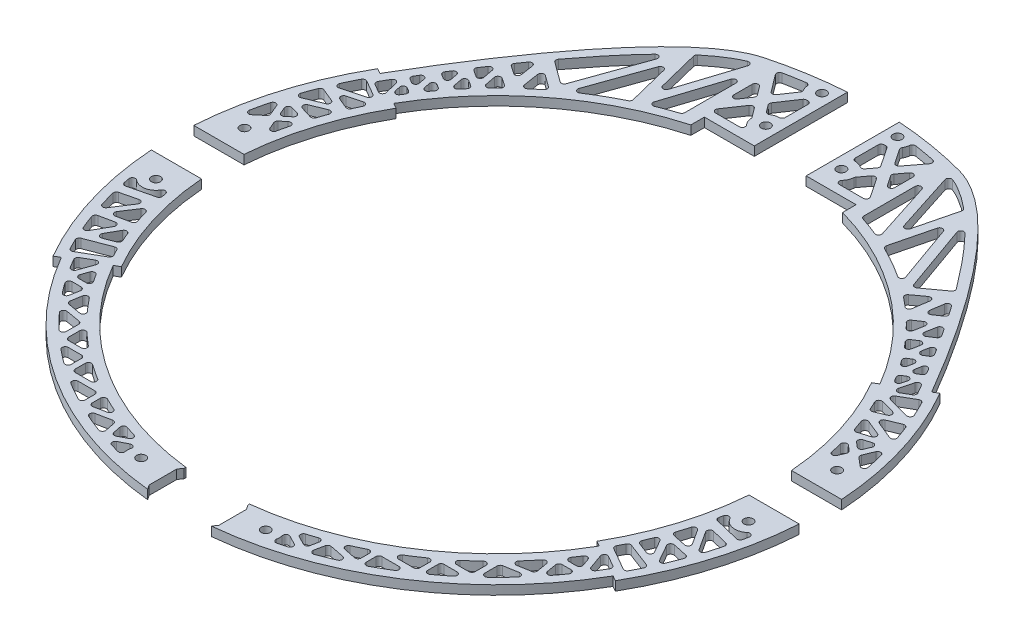
from build123d import *

# Parameters (mm, degrees)
SKETCH1_R           = 1.5
BOSS_EXTRUDE1_DEPTH = 3
CUT_EXTRUDE1_START  = -3
SKETCH2_R           = 1.5
CUT_EXTRUDE1_DEPTH  = 3
SKETCH3_R           = 1.5
CUT_EXTRUDE2_DEPTH  = 3
BOSS_EXTRUDE2_DEPTH = 3
CUT_EXTRUDE3_DEPTH  = 3
CUT_EXTRUDE4_DEPTH  = 3


with BuildPart() as part:
    # Sketch1 → Boss-Extrude1 (new body)
    with BuildSketch(Plane(origin=(0, 0, 0), x_dir=(1, 0, 0), z_dir=(0, 1, 0))):
        with BuildLine():
            Line((8.55, 124.206068692), (8.55, 93.518782826))
            Line((8.55, 93.518782826), (25, 93.518782826))
            Line((25, 93.518782826), (25, 89.057565653))
            ThreePointArc((25, 89.057565653), (0, -92.5), (-25, 89.057565653))
            Line((-25, 89.057565653), (-25, 93.518782826))
            Line((-25, 93.518782826), (-8.55, 93.518782826))
            Line((-8.55, 93.518782826), (-8.55, 124.206068692))
            ThreePointArc((-8.55, 124.206068692), (-20.481847284, 122.803680449), (-32.222971115, 120.257765373))
            add(Edge.make_bspline(
                [(-90.932667397, 52.5), (-77.178445935, 76.323010391), (-51.631984683, 115.057135862), (-32.222971115, 120.257765373)],
                knots=[0, 0, 0, 0, 1, 1, 1, 1], degree=3))
            ThreePointArc((-90.932667397, 52.5), (0, -105), (90.932667397, 52.5))
            add(Edge.make_bspline(
                [(90.932667397, 52.5), (77.178445935, 76.323010391), (51.631984683, 115.057135862), (32.222971115, 120.257765373)],
                knots=[0, 0, 0, 0, 1, 1, 1, 1], degree=3))
            ThreePointArc((32.222971115, 120.257765373), (20.481847284, 122.803680449), (8.55, 124.206068692))
        make_face()
        with Locations(Location((12.45, 101.23, 0), (0, 0, 270))):
            Circle(SKETCH1_R, mode=Mode.SUBTRACT)
        with Locations(Location((-12.45, 101.23, 0), (0, 0, 270))):
            Circle(SKETCH1_R, mode=Mode.SUBTRACT)
        with Locations(Location((12.45, 119.73, 0), (0, 0, 270))):
            Circle(SKETCH1_R, mode=Mode.SUBTRACT)
        with Locations(Location((-12.45, 119.73, 0), (0, 0, 270))):
            Circle(SKETCH1_R, mode=Mode.SUBTRACT)
    extrude(amount=BOSS_EXTRUDE1_DEPTH)

    # Sketch2 → Cut-Extrude1 (cut)
    with BuildSketch(Plane(origin=(0, 3, 0), x_dir=(1, 0, 0), z_dir=(0, 1, 0)).offset(CUT_EXTRUDE1_START)):
        with BuildLine():
            Line((-10.5, -91.902121847), (-10.5, -92.467351524))
            Line((-10.5, -92.467351524), (-11.5, -93.895499531))
            Line((-11.5, -93.895499531), (-11.5, -103.039203518))
            Line((-11.5, -103.039203518), (-10.5, -104.467351524))
            Line((-10.5, -104.467351524), (-10.5, -104.473680896))
            ThreePointArc((-10.5, -104.473680896), (0, -105), (10.5, -104.473680896))
            Line((10.5, -104.473680896), (10.5, -104.467351524))
            Line((10.5, -104.467351524), (11.5, -103.039203518))
            Line((11.5, -103.039203518), (11.5, -93.895499531))
            Line((11.5, -93.895499531), (10.5, -92.467351524))
            Line((10.5, -92.467351524), (10.5, -91.902121847))
            ThreePointArc((10.5, -91.902121847), (0, -92.5), (-10.5, -91.902121847))
        make_face()
        with Locations(Location((-20.531279468, -96.592075572, 0), (0, 0, 270))):
            Circle(SKETCH2_R)
        with Locations(Location((20.531279468, -96.592075572, 0), (0, 0, 270))):
            Circle(SKETCH2_R)
    extrude(amount=CUT_EXTRUDE1_DEPTH, mode=Mode.SUBTRACT)


with BuildPart() as cut_extrude1_piece_1:
    # of the separate pieces the step leaves, piece 1, a body of its own (cut_extrude1_pieces)
    add(part.part.solids().sort_by_distance((90.932667397, 0, -52.5))[0])


with BuildPart() as cut_extrude1_piece_2:
    # of the separate pieces the step leaves, piece 2, a body of its own (cut_extrude1_pieces)
    add(part.part.solids().sort_by_distance((-90.932667397, 0, -52.5))[0])


with BuildPart() as cut_extrude2_tool:
    # Sketch3 → Cut-Extrude2 (new body)
    with BuildSketch(Plane(origin=(0, 3, 0), x_dir=(1, 0, 0), z_dir=(0, 1, 0))):
        with Locations(Location((97.665316507, 14.596179349, 0), (0, 0, 90))):
            Circle(SKETCH3_R)
        with Locations(Location((97.665316507, -14.596179349, 0), (0, 0, 270))):
            Circle(SKETCH3_R)
        with BuildLine():
            ThreePointArc((-92.234754838, -7), (-92.5, 0), (-92.234754838, 7))
            Line((-92.234754838, 7), (-104.76640683, 7))
            ThreePointArc((-104.76640683, 7), (-105, 0), (-104.76640683, -7))
            Line((-104.76640683, -7), (-92.234754838, -7))
        make_face()
        with BuildLine():
            Line((104.76640683, 7), (92.234754838, 7))
            ThreePointArc((92.234754838, 7), (92.5, 0), (92.234754838, -7))
            Line((92.234754838, -7), (104.76640683, -7))
            ThreePointArc((104.76640683, -7), (105, 0), (104.76640683, 7))
        make_face()
        with Locations(Location((-97.665316507, 14.596179349, 0), (0, 0, 270))):
            Circle(SKETCH3_R)
        with Locations(Location((-97.665316507, -14.596179349, 0), (0, 0, 90))):
            Circle(SKETCH3_R)
    extrude(amount=-CUT_EXTRUDE2_DEPTH)


with BuildPart() as cut_extrude1_piece_1_1:
    add(cut_extrude1_piece_1.part)

    # Cut-Extrude2: cut by cut_extrude2_tool
    add(cut_extrude2_tool.part, mode=Mode.SUBTRACT)


with BuildPart() as cut_extrude1_piece_2_1:
    add(cut_extrude1_piece_2.part)

    # Cut-Extrude2: cut by cut_extrude2_tool
    add(cut_extrude2_tool.part, mode=Mode.SUBTRACT)


with BuildPart() as cut_extrude2_piece_1:
    # of the separate pieces the step leaves, piece 1, a body of its own (cut_extrude2_pieces)
    add(cut_extrude1_piece_1_1.part.solids().sort_by_distance((90.932667397, 0, -52.5))[0])



with BuildPart() as cut_extrude2_piece_2:
    # of the separate pieces the step leaves, piece 2, a body of its own (cut_extrude2_pieces)
    add(cut_extrude1_piece_1_1.part.solids().sort_by_distance((10.5, 0, 104.473680896))[0])


with BuildPart() as cut_extrude2_piece_1_of_cut_extrude1_pie:
    # of the separate pieces the step leaves, piece 1, a body of its own (cut_extrude2_pieces_of_cut_extrude1_piec)
    add(cut_extrude1_piece_2_1.part.solids().sort_by_distance((-90.932667397, 0, -52.5))[0])


with BuildPart() as cut_extrude2_piece_2_of_cut_extrude1_pie:
    # of the separate pieces the step leaves, piece 2, a body of its own (cut_extrude2_pieces_of_cut_extrude1_piec)
    add(cut_extrude1_piece_2_1.part.solids().sort_by_distance((-104.76640683, 0, 7))[0])


with BuildPart() as cut_extrude2_piece_1_1:
    add(cut_extrude2_piece_1.part)

    add(cut_extrude2_piece_2.part)  # Boss-Extrude2 merges Cut-Extrude2 piece 2

    add(cut_extrude2_piece_1_of_cut_extrude1_pie.part)  # Boss-Extrude2 merges Cut-Extrude2 piece 1 of Cut-Extrude1 pie

    add(cut_extrude2_piece_2_of_cut_extrude1_pie.part)  # Boss-Extrude2 merges Cut-Extrude2 piece 2 of Cut-Extrude1 pie
    # Sketch4 → Boss-Extrude2 (add)
    with BuildSketch(Plane(origin=(0, 3, 0), x_dir=(1, 0, 0), z_dir=(0, 1, 0))):
        with BuildLine():
            ThreePointArc((-90.228875644, 7), (-86.444245358, 26.788849258), (-78.375299042, 45.25))
            Line((-78.375299042, 45.25), (-80.10734985, 46.25))
            ThreePointArc((-80.10734985, 46.25), (-88.377547415, 27.306759473), (-92.234754838, 7))
            Line((-92.234754838, 7), (-90.228875644, 7))
        make_face()
        with BuildLine():
            Line((-80.10734985, -46.25), (-78.375299042, -45.25))
            ThreePointArc((-78.375299042, -45.25), (-86.444245358, -26.788849258), (-90.228875644, -7))
            Line((-90.228875644, -7), (-92.234754838, -7))
            ThreePointArc((-92.234754838, -7), (-88.377547415, -27.306759473), (-80.10734985, -46.25))
        make_face()
        with BuildLine():
            ThreePointArc((90.228875644, -7), (86.444245358, -26.788849258), (78.375299042, -45.25))
            Line((78.375299042, -45.25), (80.10734985, -46.25))
            ThreePointArc((80.10734985, -46.25), (88.377547415, -27.306759473), (92.234754838, -7))
            Line((92.234754838, -7), (90.228875644, -7))
        make_face()
        with BuildLine():
            Line((80.10734985, 46.25), (78.375299042, 45.25))
            ThreePointArc((78.375299042, 45.25), (86.444245358, 26.788849258), (90.228875644, 7))
            Line((90.228875644, 7), (92.234754838, 7))
            ThreePointArc((92.234754838, 7), (88.377547415, 27.306759473), (80.10734985, 46.25))
        make_face()
        with BuildLine():
            ThreePointArc((-104.76640683, 7), (-100.459416748, 30.543503183), (-90.932667397, 52.5))
            Line((-90.932667397, 52.5), (-92.664718205, 53.5))
            ThreePointArc((-92.664718205, 53.5), (-102.392344623, 31.06135481), (-106.77078252, 7))
            Line((-106.77078252, 7), (-104.76640683, 7))
        make_face()
        with BuildLine():
            Line((-92.664718205, -53.5), (-90.932667397, -52.5))
            ThreePointArc((-90.932667397, -52.5), (-100.459416748, -30.543503183), (-104.76640683, -7))
            Line((-104.76640683, -7), (-106.77078252, -7))
            ThreePointArc((-106.77078252, -7), (-102.392344623, -31.06135481), (-92.664718205, -53.5))
        make_face()
        with BuildLine():
            ThreePointArc((104.76640683, -7), (100.459416748, -30.543503183), (90.932667397, -52.5))
            Line((90.932667397, -52.5), (92.664718205, -53.5))
            ThreePointArc((92.664718205, -53.5), (102.392344623, -31.06135481), (106.77078252, -7))
            Line((106.77078252, -7), (104.76640683, -7))
        make_face()
        with BuildLine():
            Line((92.664718205, 53.5), (90.932667397, 52.5))
            ThreePointArc((90.932667397, 52.5), (100.459416748, 30.543503183), (104.76640683, 7))
            Line((104.76640683, 7), (106.77078252, 7))
            ThreePointArc((106.77078252, 7), (102.392344623, 31.06135481), (92.664718205, 53.5))
        make_face()
    extrude(amount=-BOSS_EXTRUDE2_DEPTH)

    # Sketch5 → Cut-Extrude3 (cut)
    with BuildSketch(Plane(origin=(0, 3, 0), x_dir=(1, 0, 0), z_dir=(0, 1, 0))):
        with BuildLine():
            ThreePointArc((15.771139696, 98.193549585), (15.594084197, 97.115525315), (16.509170739, 96.518782826))
            Line((16.509170739, 96.518782826), (24.312783295, 96.518782826))
            ThreePointArc((24.312783295, 96.518782826), (25.195539792, 97.048952042), (25.14227565, 98.077300895))
            Line((25.14227565, 98.077300895), (20.969415049, 104.274693892))
            ThreePointArc((20.969415049, 104.274693892), (20.167820715, 104.715786597), (19.342872494, 104.320088879))
            Line((19.342872494, 104.320088879), (17.136434804, 101.408011413))
            ThreePointArc((17.136434804, 101.408011413), (16.99863425, 101.159139295), (16.936487731, 100.881535019))
            ThreePointArc((16.936487731, 100.881535019), (16.578689614, 99.440049702), (15.771139696, 98.193549585))
        make_face()
        with BuildLine():
            Line((21.176876677, 111.708227546), (25.449565454, 117.347362866))
            ThreePointArc((25.449565454, 117.347362866), (25.589052551, 118.30184388), (24.857100444, 118.930124685))
            ThreePointArc((24.857100444, 118.930124685), (21.471750721, 119.587682982), (18.069102618, 120.148897334))
            ThreePointArc((18.069102618, 120.148897334), (17.308175343, 119.950712436), (16.925770138, 119.263650699))
            ThreePointArc((16.925770138, 119.263650699), (16.733136251, 118.349875419), (16.356043426, 117.495537033))
            ThreePointArc((16.356043426, 117.495537033), (16.224718793, 116.962506989), (16.394560722, 116.440471638))
            Line((16.394560722, 116.440471638), (19.550334122, 111.753622534))
            ThreePointArc((19.550334122, 111.753622534), (20.351928456, 111.312529828), (21.176876677, 111.708227546))
        make_face()
        with BuildLine():
            add(Edge.make_bspline(
                [(88.959591186, 49.917468245), (88.886674519, 50.043763617), (88.650753679, 50.452386883), (88.253042769, 51.141186814), (87.792023732, 51.937483892), (87.488953041, 52.457957818), (87.351699826, 52.693104953)],
                knots=[-0.015146865, -0.015146865, -0.015146865, -0.015146865, -0.009845462, 0.002005654, 0.01385677, 0.023524648, 0.023524648, 0.023524648, 0.023524648], degree=3))
            ThreePointArc((87.351699826, 52.693104953), (86.348707043, 53.179247049), (85.518830612, 52.435181346))
            Line((85.518830612, 52.435181346), (84.418009146, 48.101144507))
            ThreePointArc((84.418009146, 48.101144507), (84.783667855, 47.057653731), (85.887233849, 46.988941371))
            Line((85.887233849, 46.988941371), (88.593565782, 48.551442841))
            ThreePointArc((88.593565782, 48.551442841), (89.059491609, 49.1586492), (88.959591186, 49.917468245))
        make_face()
        with BuildLine():
            ThreePointArc((36.292776535, 88.335068752), (37.351586268, 88.525702217), (37.624762255, 89.566276121))
            Line((37.624762255, 89.566276121), (31.451956646, 108.755085379))
            ThreePointArc((31.451956646, 108.755085379), (30.345010719, 109.436768703), (29.5, 108.448852552))
            Line((29.5, 108.448852552), (29.5, 91.553263186))
            ThreePointArc((29.5, 91.553263186), (29.688808846, 90.968482106), (30.183937824, 90.604524707))
            ThreePointArc((30.183937824, 90.604524707), (33.257720842, 89.521919128), (36.292776535, 88.335068752))
        make_face()
        with BuildLine():
            ThreePointArc((91.558654112, 18.954230588), (92.437385792, 18.165650654), (93.450568977, 18.771858135))
            Line((93.450568977, 18.771858135), (94.38215342, 20.997996722))
            ThreePointArc((94.38215342, 20.997996722), (94.431387061, 21.620181583), (94.102100027, 22.150377774))
            Line((94.102100027, 22.150377774), (92.334283145, 23.632346882))
            ThreePointArc((92.334283145, 23.632346882), (91.161715709, 23.71391428), (90.721568957, 22.624034254))
            ThreePointArc((90.721568957, 22.624034254), (91.158580481, 20.793345202), (91.558654112, 18.954230588))
        make_face()
        with BuildLine():
            add(Edge.make_bspline(
                [(65.576485339, 85.982407931), (65.451859982, 86.149877435), (64.425754559, 87.525250843), (61.093004912, 91.898768129), (57.241981977, 96.59791856), (54.020874303, 100.210119699), (52.861563451, 101.474730679), (51.992695079, 102.404383534), (51.414099417, 103.011086715), (51.125025587, 103.311039195)],
                knots=[0.431471777, 0.431471777, 0.431471777, 0.431471777, 0.437594107, 0.481823762, 0.593562485, 0.621121653, 0.634901237, 0.64868082, 0.662460404, 0.662460404, 0.662460404, 0.662460404], degree=3))
            ThreePointArc((51.125025587, 103.311039195), (49.878518211, 103.467307685), (49.462876453, 102.281794121))
            Line((49.462876453, 102.281794121), (57.293930119, 80.27962879))
            ThreePointArc((57.293930119, 80.27962879), (57.941222423, 79.659390035), (58.825451357, 79.807114889))
            Line((58.825451357, 79.807114889), (65.363660534, 84.577576759))
            ThreePointArc((65.363660534, 84.577576759), (65.762963443, 85.235620917), (65.576485339, 85.982407931))
        make_face()
        with BuildLine():
            ThreePointArc((52.346038416, 79.875792717), (53.512251958, 79.926079134), (53.836270155, 81.047504547))
            Line((53.836270155, 81.047504547), (46.977775231, 100.317164245))
            ThreePointArc((46.977775231, 100.317164245), (45.986895055, 100.980657967), (45.065375499, 100.223776768))
            Line((45.065375499, 100.223776768), (41.715312962, 86.787806359))
            ThreePointArc((41.715312962, 86.787806359), (41.778366377, 86.125265771), (42.243269116, 85.649029267))
            ThreePointArc((42.243269116, 85.649029267), (47.382663917, 82.916422741), (52.346038416, 79.875792717))
        make_face()
        with BuildLine():
            ThreePointArc((66.920240095, 68.131721434), (67.780188465, 67.27626663), (68.629202271, 66.409958557))
            ThreePointArc((68.629202271, 66.409958557), (69.633403078, 66.146993064), (70.329881739, 66.916725216))
            Line((70.329881739, 66.916725216), (70.973259254, 70.266367943))
            ThreePointArc((70.973259254, 70.266367943), (70.54087792, 71.290376888), (69.429355738, 71.282229635))
            Line((69.429355738, 71.282229635), (67.059121155, 69.672378716))
            ThreePointArc((67.059121155, 69.672378716), (66.625013972, 68.934922598), (66.920240095, 68.131721434))
        make_face()
        with BuildLine():
            ThreePointArc((38.879836652, 95.461214294), (39.865227157, 94.768006189), (40.802087348, 95.525518504))
            Line((40.802087348, 95.525518504), (44.190986639, 109.117250032))
            ThreePointArc((44.190986639, 109.117250032), (44.170954431, 109.670630784), (43.859541965, 110.128510486))
            add(Edge.make_bspline(
                [(43.859541965, 110.128510486), (43.714200276, 110.249201511), (43.178837474, 110.689972499), (41.339002971, 112.15592036), (39.040680832, 113.782507978), (36.580089233, 115.23991269), (35.126404338, 115.978964725), (34.220431062, 116.381321735), (33.89740265, 116.516295368), (33.82601455, 116.545703493)],
                knots=[0.779326404, 0.779326404, 0.779326404, 0.779326404, 0.786470938, 0.805683911, 0.870455941, 0.902841955, 0.93522797, 0.949449093, 0.953497345, 0.953497345, 0.953497345, 0.953497345], degree=3))
            ThreePointArc((33.82601455, 116.545703493), (32.766683338, 116.355743232), (32.493163859, 115.314851973))
            Line((32.493163859, 115.314851973), (38.879836652, 95.461214294))
        make_face()
        with BuildLine():
            ThreePointArc((81.649002717, 56.179477011), (82.056589073, 55.172320689), (83.142323212, 55.13143213))
            Line((83.142323212, 55.13143213), (84.329922148, 55.837938707))
            ThreePointArc((84.329922148, 55.837938707), (84.788383712, 56.453190144), (84.67594278, 57.212188414))
            add(Edge.make_bspline(
                [(84.67594278, 57.212188414), (84.610035047, 57.321937517), (84.477849627, 57.541826039), (84.278470121, 57.872807104), (84.07799773, 58.204913791), (83.943626543, 58.427053554), (83.876261633, 58.538303485)],
                knots=[0.083568359, 0.083568359, 0.083568359, 0.083568359, 0.087823193, 0.092078027, 0.096332862, 0.100587696, 0.100587696, 0.100587696, 0.100587696], degree=3))
            ThreePointArc((83.876261633, 58.538303485), (82.844434309, 59.004648862), (82.038812719, 58.2089608))
            Line((82.038812719, 58.2089608), (81.649002717, 56.179477011))
        make_face()
        with BuildLine():
            add(Edge.make_bspline(
                [(76.554021543, 70.185674015), (76.462254536, 70.326147652), (76.242099412, 70.662659737), (75.892098303, 71.195754797), (75.515806706, 71.766509828), (75.267783546, 72.141200933), (75.14963253, 72.31934865)],
                knots=[0.243154782, 0.243154782, 0.243154782, 0.243154782, 0.248174192, 0.255172678, 0.262171163, 0.268509957, 0.268509957, 0.268509957, 0.268509957], degree=3))
            ThreePointArc((75.14963253, 72.31934865), (74.119623496, 72.747115689), (73.334209586, 71.955264541))
            Line((73.334209586, 71.955264541), (72.669315142, 68.493597341))
            ThreePointArc((72.669315142, 68.493597341), (73.09202733, 67.476031329), (74.193845081, 67.464903602))
            Line((74.193845081, 67.464903602), (76.259311367, 68.798695288))
            ThreePointArc((76.259311367, 68.798695288), (76.694992627, 69.430920081), (76.554021543, 70.185674015))
        make_face()
        with BuildLine():
            ThreePointArc((80.369978822, 62.331958075), (80.817663469, 62.955510747), (80.691459104, 63.712684397))
            add(Edge.make_bspline(
                [(80.691459104, 63.712684397), (80.616427748, 63.832606707), (80.466026789, 64.072714457), (80.239420064, 64.433640336), (80.011817511, 64.795305334), (79.859424897, 65.03689132), (79.78306577, 65.157799121)],
                knots=[0.165136897, 0.165136897, 0.165136897, 0.165136897, 0.169541528, 0.173946158, 0.178350789, 0.182755419, 0.182755419, 0.182755419, 0.182755419], degree=3))
            ThreePointArc((79.78306577, 65.157799121), (78.751883089, 65.60643447), (77.955516123, 64.812450179))
            Line((77.955516123, 64.812450179), (77.519028403, 62.53994627))
            ThreePointArc((77.519028403, 62.53994627), (77.933814216, 61.527784179), (79.027341513, 61.500999477))
            Line((79.027341513, 61.500999477), (80.369978822, 62.331958075))
        make_face()
        with BuildLine():
            ThreePointArc((100.337441123, 19.533055206), (101.490362199, 19.439516486), (101.96025825, 20.496481103))
            ThreePointArc((101.96025825, 20.496481103), (101.34790981, 23.336691651), (100.656460464, 26.158688173))
            ThreePointArc((100.656460464, 26.158688173), (99.759587607, 26.904640226), (98.766126461, 26.29319903))
            Line((98.766126461, 26.29319903), (97.36420905, 22.943140463))
            ThreePointArc((97.36420905, 22.943140463), (97.314975409, 22.320955602), (97.644262443, 21.79075941))
            Line((97.644262443, 21.79075941), (100.337441123, 19.533055206))
        make_face()
        with BuildLine():
            add(Edge.make_bspline(
                [(71.584188946, 77.590303623), (71.465264634, 77.762581422), (71.16135202, 78.201928449), (70.703462679, 78.860340295), (70.210285796, 79.565228326), (69.902315661, 80.00297908), (69.748022917, 80.221677404)],
                knots=[0.330931187, 0.330931187, 0.330931187, 0.330931187, 0.337056351, 0.346556359, 0.354368946, 0.362181532, 0.362181532, 0.362181532, 0.362181532], degree=3))
            ThreePointArc((69.748022917, 80.221677404), (68.702001425, 80.618648044), (67.9425152, 79.797108437))
            Line((67.9425152, 79.797108437), (67.279065931, 75.480363684))
            ThreePointArc((67.279065931, 75.480363684), (67.733451987, 74.482976221), (68.82931495, 74.501219198))
            Line((68.82931495, 74.501219198), (71.323080811, 76.194971916))
            ThreePointArc((71.323080811, 76.194971916), (71.744164409, 76.838271038), (71.584188946, 77.590303623))
        make_face()
        with BuildLine():
            ThreePointArc((12.531818182, 115.230743863), (11.836493932, 114.931558216), (11.55, 114.230909166))
            Line((11.55, 114.230909166), (11.55, 106.729090834))
            ThreePointArc((11.55, 106.729090834), (11.836493932, 106.028441784), (12.531818182, 105.729256137))
            ThreePointArc((12.531818182, 105.729256137), (13.777397803, 105.529769188), (14.918669283, 104.99240242))
            ThreePointArc((14.918669283, 104.99240242), (15.637289485, 104.843052447), (16.264312657, 105.224578791))
            Line((16.264312657, 105.224578791), (17.985312249, 107.495970434))
            ThreePointArc((17.985312249, 107.495970434), (18.187872824, 108.071985469), (18.017754404, 108.658401559))
            Line((18.017754404, 108.658401559), (13.868868703, 114.820187837))
            ThreePointArc((13.868868703, 114.820187837), (13.461164272, 115.168364285), (12.932217012, 115.255911629))
            ThreePointArc((12.932217012, 115.255911629), (12.732298209, 115.238863427), (12.531818182, 115.230743863))
        make_face()
        with BuildLine():
            ThreePointArc((24.670507645, 104.149312069), (25.791982572, 103.751406498), (26.5, 104.707830137))
            Line((26.5, 104.707830137), (26.5, 110.790456873))
            ThreePointArc((26.5, 110.790456873), (25.818551252, 111.738362512), (24.7029498, 111.394369929))
            Line((24.7029498, 111.394369929), (22.534436922, 108.532345991))
            ThreePointArc((22.534436922, 108.532345991), (22.331876347, 107.956330956), (22.501994767, 107.369914866))
            Line((22.501994767, 107.369914866), (24.670507645, 104.149312069))
        make_face()
        with BuildLine():
            Line((63.091095996, 79.205796917), (59.323143512, 76.456592484))
            ThreePointArc((59.323143512, 76.456592484), (58.912754077, 75.668510406), (59.291703534, 74.864837488))
            ThreePointArc((59.291703534, 74.864837488), (60.772898101, 73.667529186), (62.229920881, 72.440920391))
            ThreePointArc((62.229920881, 72.440920391), (63.228465997, 72.261570412), (63.86993767, 73.04755569))
            Line((63.86993767, 73.04755569), (64.668906132, 78.24605855))
            ThreePointArc((64.668906132, 78.24605855), (64.200194627, 79.252326038), (63.091095996, 79.205796917))
        make_face()
        with BuildLine():
            Line((74.256842297, 65.124825371), (72.452061867, 63.959373701))
            ThreePointArc((72.452061867, 63.959373701), (72.004638611, 63.261044165), (72.238122597, 62.465219472))
            ThreePointArc((72.238122597, 62.465219472), (72.879655804, 61.715522924), (73.513408925, 60.959238088))
            ThreePointArc((73.513408925, 60.959238088), (74.531820521, 60.628958153), (75.265231918, 61.408929139))
            Line((75.265231918, 61.408929139), (75.781372236, 64.096131632))
            ThreePointArc((75.781372236, 64.096131632), (75.358660048, 65.113697644), (74.256842297, 65.124825371))
        make_face()
        with BuildLine():
            Line((78.400407474, 58.760937493), (77.212084142, 58.025483857))
            ThreePointArc((77.212084142, 58.025483857), (76.756576089, 57.365224668), (76.932769436, 56.58267391))
            ThreePointArc((76.932769436, 56.58267391), (77.3443434, 56.018769569), (77.751784124, 55.451871615))
            ThreePointArc((77.751784124, 55.451871615), (78.779170005, 55.055517689), (79.547988009, 55.843893907))
            Line((79.547988009, 55.843893907), (79.908720584, 57.7219907))
            ThreePointArc((79.908720584, 57.7219907), (79.493934771, 58.734152791), (78.400407474, 58.760937493))
        make_face()
        with BuildLine():
            Line((82.328428862, 52.901879094), (81.184512487, 52.221359419))
            ThreePointArc((81.184512487, 52.221359419), (80.723605744, 51.596182783), (80.849195469, 50.829692031))
            ThreePointArc((80.849195469, 50.829692031), (81.191807227, 50.280616933), (81.530690085, 49.729232594))
            ThreePointArc((81.530690085, 49.729232594), (82.533341139, 49.261109282), (83.353639291, 50.00377981))
            Line((83.353639291, 50.00377981), (83.808924981, 51.796282059))
            ThreePointArc((83.808924981, 51.796282059), (83.438045082, 52.843698517), (82.328428862, 52.901879094))
        make_face()
        with BuildLine():
            Line((90.980713201, 48.197612239), (86.098738616, 45.379002898))
            ThreePointArc((86.098738616, 45.379002898), (85.607293755, 44.382451302), (86.339919571, 43.547051668))
            Line((86.339919571, 43.547051668), (93.524269183, 41.622010991))
            ThreePointArc((93.524269183, 41.622010991), (94.545888189, 41.941302284), (94.693603648, 43.001411932))
            ThreePointArc((94.693603648, 43.001411932), (93.56189444, 45.411143003), (92.368875465, 47.791116804))
            ThreePointArc((92.368875465, 47.791116804), (91.761741883, 48.291286204), (90.980713201, 48.197612239))
        make_face()
        with BuildLine():
            Line((90.097162893, 40.469748993), (85.532279791, 41.692905734))
            ThreePointArc((85.532279791, 41.692905734), (84.504455183, 41.366221993), (84.371096082, 40.296006575))
            ThreePointArc((84.371096082, 40.296006575), (84.976023915, 39.004171054), (85.561173404, 37.703257231))
            ThreePointArc((85.561173404, 37.703257231), (86.104489124, 37.178178573), (86.860052198, 37.183078573))
            Line((86.860052198, 37.183078573), (90.222129879, 38.580401117))
            ThreePointArc((90.222129879, 38.580401117), (90.836163557, 39.569821876), (90.097162893, 40.469748993))
        make_face()
        with BuildLine():
            Line((93.899277926, 31.681531398), (89.016760577, 33.697111218))
            ThreePointArc((89.016760577, 33.697111218), (87.941399874, 33.492962119), (87.697241872, 32.425973662))
            ThreePointArc((87.697241872, 32.425973662), (88.259929539, 30.861543024), (88.794711826, 29.287354808))
            ThreePointArc((88.794711826, 29.287354808), (89.284930016, 28.712388987), (90.037452507, 28.644495913))
            Line((90.037452507, 28.644495913), (93.810762256, 29.801103063))
            ThreePointArc((93.810762256, 29.801103063), (94.516591585, 30.710175685), (93.899277926, 31.681531398))
        make_face()
        with BuildLine():
            ThreePointArc((96.79281112, 38.041447337), (96.252647872, 38.596251481), (95.478324982, 38.59908624))
            Line((95.478324982, 38.59908624), (91.182423796, 36.813654688))
            ThreePointArc((91.182423796, 36.813654688), (90.566210539, 35.889038899), (91.184629538, 34.96589694))
            Line((91.184629538, 34.96589694), (97.02559144, 32.55465616))
            ThreePointArc((97.02559144, 32.55465616), (98.092585538, 32.750838091), (98.352872425, 33.804030614))
            ThreePointArc((98.352872425, 33.804030614), (97.595842005, 35.931206817), (96.79281112, 38.041447337))
        make_face()
        with BuildLine():
            ThreePointArc((96.864834576, 26.930676643), (96.683546001, 27.9880033), (95.649286537, 28.272805984))
            Line((95.649286537, 28.272805984), (93.208450333, 27.524632949))
            ThreePointArc((93.208450333, 27.524632949), (92.521471661, 26.767324494), (92.859084922, 25.802195965))
            Line((92.859084922, 25.802195965), (94.434246641, 24.481730575))
            ThreePointArc((94.434246641, 24.481730575), (95.312824826, 24.276357861), (95.999160091, 24.862038218))
            Line((95.999160091, 24.862038218), (96.864834576, 26.930676643))
        make_face()
    cut_extrude3 = extrude(amount=-CUT_EXTRUDE3_DEPTH, mode=Mode.SUBTRACT)

    # Mirror1: Cut-Extrude3 across plane
    add(cut_extrude3.mirror(Plane(origin=(0, 0, 0), x_dir=(0, 0, 1), z_dir=(1, 0, 0))), mode=Mode.SUBTRACT)

    # Sketch6 → Cut-Extrude4 (cut)
    with BuildSketch(Plane(origin=(0, 3, 0), x_dir=(1, 0, 0), z_dir=(0, 1, 0))):
        with BuildLine():
            ThreePointArc((-91.678772999, -18.364437956), (-91.815526982, -19.097557683), (-92.421556003, -19.53217822))
            Line((-92.421556003, -19.53217822), (-100.684648168, -21.554619536))
            ThreePointArc((-100.684648168, -21.554619536), (-101.457619712, -21.427994895), (-101.902215798, -20.783128143))
            ThreePointArc((-101.902215798, -20.783128143), (-102.087340514, -19.853838589), (-102.263990827, -18.922900941))
            ThreePointArc((-102.263990827, -18.922900941), (-101.776036858, -17.872258554), (-100.62334382, -17.987355312))
            ThreePointArc((-100.62334382, -17.987355312), (-96.921590463, -19.034295117), (-93.763365353, -16.837780828))
            ThreePointArc((-93.763365353, -16.837780828), (-92.728585284, -16.350072981), (-91.913235836, -17.152465659))
            ThreePointArc((-91.913235836, -17.152465659), (-91.798004587, -17.758838752), (-91.678772999, -18.364437956))
        make_face()
        with BuildLine():
            ThreePointArc((-97.603241542, -30.84543488), (-98.580162082, -31.291492522), (-99.397838729, -30.595255448))
            ThreePointArc((-99.397838729, -30.595255448), (-100.115502305, -28.158234997), (-100.773425087, -25.704412001))
            ThreePointArc((-100.773425087, -25.704412001), (-100.66189793, -24.942683709), (-100.042188478, -24.48592503))
            Line((-100.042188478, -24.48592503), (-94.685683475, -23.174888337))
            ThreePointArc((-94.685683475, -23.174888337), (-93.632674814, -23.567136521), (-93.609096106, -24.69058208))
            Line((-93.609096106, -24.69058208), (-97.603241542, -30.84543488))
        make_face()
        with BuildLine():
            ThreePointArc((-88.687550748, -29.61027427), (-88.767962182, -30.423318658), (-89.427848957, -30.905041212))
            Line((-89.427848957, -30.905041212), (-93.830974566, -31.842460423))
            ThreePointArc((-93.830974566, -31.842460423), (-94.863147119, -31.43105678), (-94.878055049, -30.320016327))
            Line((-94.878055049, -30.320016327), (-91.700806191, -25.423975524))
            ThreePointArc((-91.700806191, -25.423975524), (-90.713877731, -24.979364677), (-89.900455258, -25.693542854))
            ThreePointArc((-89.900455258, -25.693542854), (-89.315475527, -27.658558015), (-88.687550748, -29.61027427))
        make_face()
        with BuildLine():
            ThreePointArc((-97.621418969, -35.861658613), (-96.781256152, -38.070834739), (-95.89110699, -40.26034774))
            ThreePointArc((-95.89110699, -40.26034774), (-95.028218159, -40.871478648), (-94.099206204, -40.366508442))
            Line((-94.099206204, -40.366508442), (-91.054321973, -34.997024012))
            ThreePointArc((-91.054321973, -34.997024012), (-91.117554252, -33.912699647), (-92.13242463, -33.525665065))
            Line((-92.13242463, -33.525665065), (-96.890983224, -34.538755456))
            ThreePointArc((-96.890983224, -34.538755456), (-97.558172894, -35.033474501), (-97.621418969, -35.861658613))
        make_face()
        with BuildLine():
            ThreePointArc((-85.596328946, -37.623376656), (-85.589219926, -38.411576861), (-86.155317799, -38.960068701))
            Line((-86.155317799, -38.960068701), (-89.742764249, -40.328845837))
            ThreePointArc((-89.742764249, -40.328845837), (-90.857789125, -40.04616354), (-90.969115066, -38.901263417))
            Line((-90.969115066, -38.901263417), (-88.569407662, -34.66951253))
            ThreePointArc((-88.569407662, -34.66951253), (-87.640283763, -34.169361536), (-86.786683792, -34.789675428))
            ThreePointArc((-86.786683792, -34.789675428), (-86.203150962, -36.211417595), (-85.596328946, -37.623376656))
        make_face()
        with BuildLine():
            ThreePointArc((-93.694119472, -45.137700168), (-92.871002659, -46.807871828), (-92.018116684, -48.463039545))
            ThreePointArc((-92.018116684, -48.463039545), (-91.41085671, -48.957765864), (-90.6333271, -48.863074184))
            Line((-90.6333271, -48.863074184), (-84.164608509, -45.128357764))
            Line((-84.164608509, -45.128357764), (-83.26605347, -44.60957677))
            ThreePointArc((-83.26605347, -44.60957677), (-82.805822971, -44.022759871), (-82.879640205, -43.280656643))
            ThreePointArc((-82.879640205, -43.280656643), (-83.407725148, -42.25401029), (-83.923093434, -41.220921732))
            ThreePointArc((-83.923093434, -41.220921732), (-84.454516886, -40.731231259), (-85.177146531, -40.727484215))
            Line((-85.177146531, -40.727484215), (-93.149694382, -43.76938083))
            ThreePointArc((-93.149694382, -43.76938083), (-93.72236928, -44.333992935), (-93.694119472, -45.137700168))
        make_face()
        with BuildLine():
            ThreePointArc((-84.557016452, -47.664315672), (-83.417151462, -47.761853734), (-83.114745526, -48.865192539))
            Line((-83.114745526, -48.865192539), (-84.823941121, -53.674863378))
            ThreePointArc((-84.823941121, -53.674863378), (-85.658950662, -54.334242771), (-86.615382463, -53.868130845))
            ThreePointArc((-86.615382463, -53.868130845), (-87.486741073, -52.441111128), (-88.334591186, -51))
            ThreePointArc((-88.334591186, -51), (-88.434491609, -50.241180955), (-87.968565782, -49.633974596))
            Line((-87.968565782, -49.633974596), (-84.557016452, -47.664315672))
        make_face()
        with BuildLine():
            ThreePointArc((-78.708236448, -54.085705276), (-78.647436841, -55.1176965), (-79.532406463, -55.65204774))
            Line((-79.532406463, -55.65204774), (-81.987401955, -55.65204774))
            ThreePointArc((-81.987401955, -55.65204774), (-82.804363233, -55.228740265), (-82.92967288, -54.317196277))
            Line((-82.92967288, -54.317196277), (-82.074958703, -51.912033364))
            ThreePointArc((-82.074958703, -51.912033364), (-81.247770116, -51.253528871), (-80.291934536, -51.705466331))
            ThreePointArc((-80.291934536, -51.705466331), (-79.508993061, -52.901512478), (-78.708236448, -54.085705276))
        make_face()
        with BuildLine():
            ThreePointArc((-83.039027056, -59.232761084), (-81.839938373, -60.878768772), (-80.608227342, -62.500509476))
            ThreePointArc((-80.608227342, -62.500509476), (-79.576316987, -62.858126941), (-78.832610109, -62.058358655))
            Line((-78.832610109, -62.058358655), (-78.272387473, -58.822647012))
            ThreePointArc((-78.272387473, -58.822647012), (-78.492679186, -58.008075408), (-79.257727966, -57.65204774))
            Line((-79.257727966, -57.65204774), (-82.224918947, -57.65204774))
            ThreePointArc((-82.224918947, -57.65204774), (-83.11393901, -58.194179497), (-83.039027056, -59.232761084))
        make_face()
        with BuildLine():
            Line((-76.234018783, -64.634587357), (-72.06345097, -65.356668542))
            ThreePointArc((-72.06345097, -65.356668542), (-71.018156169, -64.856000856), (-71.147848054, -63.704267654))
            ThreePointArc((-71.147848054, -63.704267654), (-72.941837482, -61.642017689), (-74.676073243, -59.529270825))
            ThreePointArc((-74.676073243, -59.529270825), (-75.706187606, -59.183896441), (-76.443362148, -59.982014703))
            Line((-76.443362148, -59.982014703), (-77.048760006, -63.478647592))
            ThreePointArc((-77.048760006, -63.478647592), (-76.880792359, -64.225355906), (-76.234018783, -64.634587357))
        make_face()
        with BuildLine():
            ThreePointArc((-68.975019083, -72.831975837), (-69.583114739, -73.751981808), (-70.667841054, -73.553084509))
            ThreePointArc((-70.667841054, -73.553084509), (-73.113178977, -71.122872973), (-75.47499187, -68.611410146))
            ThreePointArc((-75.47499187, -68.611410146), (-75.611558203, -67.457378783), (-74.564441697, -66.953408769))
            Line((-74.564441697, -66.953408769), (-69.804419811, -67.777546488))
            ThreePointArc((-69.804419811, -67.777546488), (-69.209970303, -68.118914649), (-68.975019083, -68.762886981))
            Line((-68.975019083, -68.762886981), (-68.975019083, -72.831975837))
        make_face()
        with BuildLine():
            Line((-65.975019083, -75.048647461), (-61.879300328, -75.048647461))
            ThreePointArc((-61.879300328, -75.048647461), (-60.939262165, -74.389716738), (-61.238064056, -73.281303964))
            ThreePointArc((-61.238064056, -73.281303964), (-63.290119598, -71.516506915), (-65.291340128, -69.69426737))
            ThreePointArc((-65.291340128, -69.69426737), (-66.372713089, -69.506532167), (-66.975019083, -70.424050274))
            Line((-66.975019083, -70.424050274), (-66.975019083, -74.048647461))
            ThreePointArc((-66.975019083, -74.048647461), (-66.682125864, -74.755754243), (-65.975019083, -75.048647461))
        make_face()
        with BuildLine():
            ThreePointArc((-64.739369023, -78.821406347), (-62.571455431, -80.553168561), (-60.357239626, -82.225322284))
            ThreePointArc((-60.357239626, -82.225322284), (-59.313693197, -82.311306477), (-58.765501983, -81.419191674))
            Line((-58.765501983, -81.419191674), (-58.765501983, -78.048647461))
            ThreePointArc((-58.765501983, -78.048647461), (-59.058395201, -77.34154068), (-59.765501983, -77.048647461))
            Line((-59.765501983, -77.048647461), (-64.104669326, -77.048647461))
            ThreePointArc((-64.104669326, -77.048647461), (-65.046146593, -77.711570976), (-64.739369023, -78.821406347))
        make_face()
        with BuildLine():
            ThreePointArc((-50.241699035, -81.215895477), (-49.805909616, -82.339793787), (-50.767790124, -83.066323702))
            Line((-50.767790124, -83.066323702), (-55.765501983, -83.066323702))
            ThreePointArc((-55.765501983, -83.066323702), (-56.472608764, -82.773430483), (-56.765501983, -82.066323702))
            Line((-56.765501983, -82.066323702), (-56.765501983, -78.755690516))
            ThreePointArc((-56.765501983, -78.755690516), (-56.224914189, -77.867467332), (-55.187621133, -77.939569371))
            ThreePointArc((-55.187621133, -77.939569371), (-52.740107754, -79.616148073), (-50.241699035, -81.215895477))
        make_face()
        with BuildLine():
            ThreePointArc((-41.028517461, -93.384478127), (-38.302462286, -94.535291732), (-35.544172707, -95.606546777))
            ThreePointArc((-35.544172707, -95.606546777), (-34.545368556, -95.428877913), (-34.215870329, -94.469395304))
            Line((-34.215870329, -94.469395304), (-34.863548926, -91.293658917))
            ThreePointArc((-34.863548926, -91.293658917), (-35.291837353, -90.659343962), (-36.043211409, -90.513661207))
            Line((-36.043211409, -90.513661207), (-40.82610948, -91.489113931))
            ThreePointArc((-40.82610948, -91.489113931), (-41.62062324, -92.362756733), (-41.028517461, -93.384478127))
        make_face()
        with BuildLine():
            ThreePointArc((-38.921339635, -87.208825935), (-38.334859482, -88.231083045), (-39.129060543, -89.101837455))
            Line((-39.129060543, -89.101837455), (-43.111349669, -89.914009222))
            ThreePointArc((-43.111349669, -89.914009222), (-43.943703839, -89.708721696), (-44.311182056, -88.934179126))
            Line((-44.311182056, -88.934179126), (-44.311182056, -86.234514604))
            ThreePointArc((-44.311182056, -86.234514604), (-43.836148465, -85.383391657), (-42.862361516, -85.340892691))
            ThreePointArc((-42.862361516, -85.340892691), (-40.902515047, -86.297359536), (-38.921339635, -87.208825935))
        make_face()
        with BuildLine():
            ThreePointArc((-53.377713997, -86.91846552), (-50.60394251, -88.562074289), (-47.779609601, -90.117195398))
            ThreePointArc((-47.779609601, -90.117195398), (-46.795637463, -90.090556232), (-46.311182056, -89.233693482))
            Line((-46.311182056, -89.233693482), (-46.311182056, -86.066323702))
            ThreePointArc((-46.311182056, -86.066323702), (-46.604075275, -85.35921692), (-47.311182056, -85.066323702))
            Line((-47.311182056, -85.066323702), (-52.854403076, -85.066323702))
            ThreePointArc((-52.854403076, -85.066323702), (-53.816728857, -85.794424657), (-53.377713997, -86.91846552))
        make_face()
        with BuildLine():
            ThreePointArc((-28.254425096, -91.224653809), (-27.554098079, -92.092617796), (-28.092845145, -93.069127403))
            Line((-28.092845145, -93.069127403), (-30.872040951, -94.498782971))
            ThreePointArc((-30.872040951, -94.498782971), (-31.761965401, -94.511181693), (-32.309308852, -93.80937374))
            Line((-32.309308852, -93.80937374), (-32.822117321, -91.294940621))
            ThreePointArc((-32.822117321, -91.294940621), (-32.500057526, -90.341889654), (-31.512315336, -90.151117476))
            ThreePointArc((-31.512315336, -90.151117476), (-29.88819057, -90.702514102), (-28.254425096, -91.224653809))
        make_face()
        with BuildLine():
            ThreePointArc((-24.906044084, -95.537829608), (-25.029888583, -96.480200486), (-24.953039503, -97.427562376))
            ThreePointArc((-24.953039503, -97.427562376), (-25.254802627, -98.34564879), (-26.192441486, -98.579693695))
            ThreePointArc((-26.192441486, -98.579693695), (-27.641956382, -98.183105713), (-29.085471094, -97.76520532))
            ThreePointArc((-29.085471094, -97.76520532), (-29.796000491, -96.899562557), (-29.257757222, -95.917481297))
            Line((-29.257757222, -95.917481297), (-26.335651804, -94.41431111))
            ThreePointArc((-26.335651804, -94.41431111), (-25.26030564, -94.517302602), (-24.906044084, -95.537829608))
        make_face()
    cut_extrude4 = extrude(amount=-CUT_EXTRUDE4_DEPTH, mode=Mode.SUBTRACT)

    # Mirror2: Cut-Extrude4 across plane
    add(cut_extrude4.mirror(Plane(origin=(0, 0, 0), x_dir=(0, 0, 1), z_dir=(1, 0, 0))), mode=Mode.SUBTRACT)


solid = cut_extrude2_piece_1_1.part
